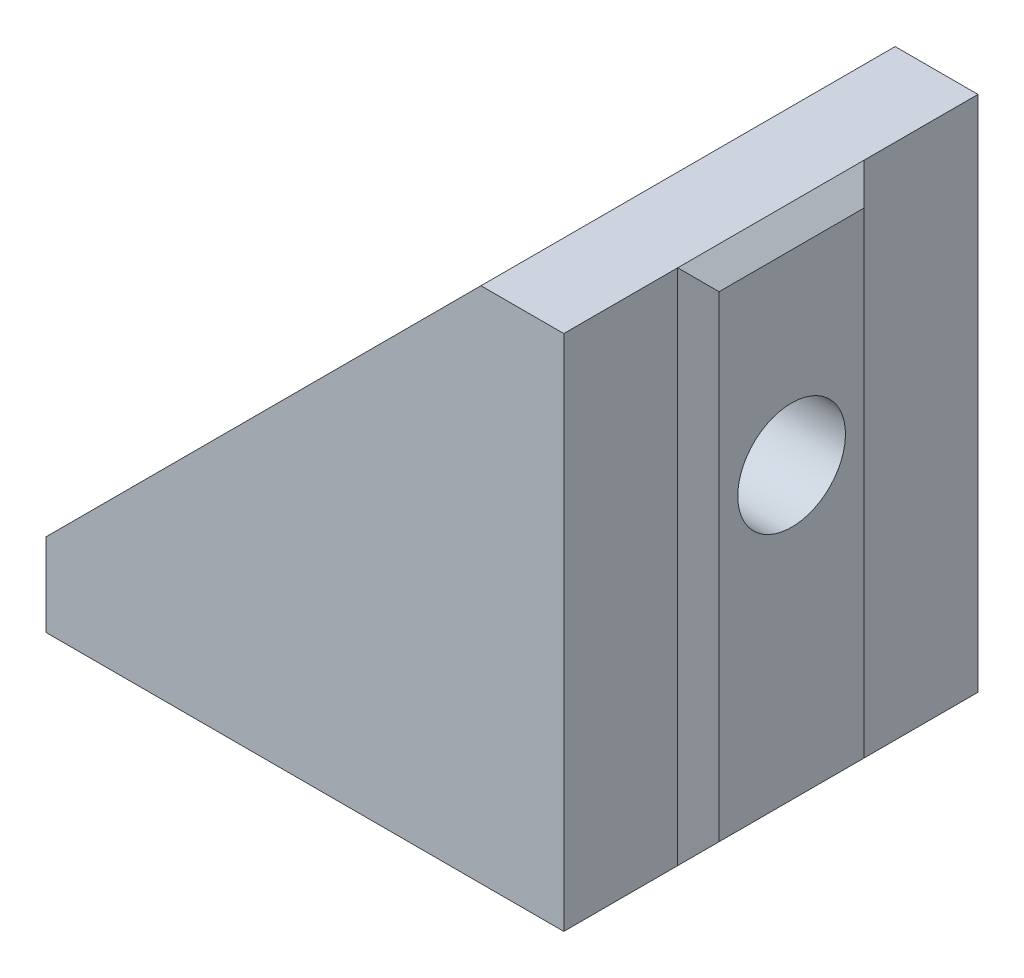
from build123d import *

# Parameters (mm, degrees)
BOSS_EXTRUDE1_DEPTH = 20
SKETCH2_W           = 9
SKETCH2_H           = 25
BOSS_EXTRUDE2_DEPTH = 1
BOSS_EXTRUDE2_TAPER = 45
SKETCH3_W           = 25
SKETCH3_H           = 9
BOSS_EXTRUDE3_DEPTH = 1
BOSS_EXTRUDE3_TAPER = 45
CUT_EXTRUDE3_DEPTH  = 3.5
SKETCH9_W           = 10
SKETCH9_H           = 8.5
CUT_EXTRUDE4_DEPTH  = 7
CHAMFER3_START      = 7.5
CHAMFER3_DEPTH      = 5
CHAMFER3_START_2    = 5
CHAMFER3_2_DEPTH    = 10
CHAMFER3_START_3    = 0.671572875
CHAMFER3_3_DEPTH    = 2.5
CUT_EXTRUDE5_REACH  = 43.857
SKETCH4_R           = 2.6
CUT_EXTRUDE6_REACH  = 43.243
SKETCH5_R           = 2.6


with BuildPart() as part:
    # Sketch1 → Boss-Extrude1 (new body)
    with BuildSketch(Plane.XY):
        Polygon((0, 0), (0, 4), (21, 25), (25, 25), (25, 0), align=None)
    extrude(amount=BOSS_EXTRUDE1_DEPTH)

    # Sketch2 → Boss-Extrude2 (add)
    with BuildSketch(Plane(origin=(25, 0, 0), x_dir=(0, 0, -1), z_dir=(1, 0, 0))):
        with Locations((-10, 12.5)):
            Rectangle(SKETCH2_W, SKETCH2_H)
    extrude(amount=BOSS_EXTRUDE2_DEPTH, taper=BOSS_EXTRUDE2_TAPER)

    # Sketch3 → Boss-Extrude3 (add)
    with BuildSketch(Plane.XZ):
        with Locations((12.5, 10)):
            Rectangle(SKETCH3_W, SKETCH3_H)
    extrude(amount=BOSS_EXTRUDE3_DEPTH, taper=BOSS_EXTRUDE3_TAPER)

    # Sketch7 → Cut-Extrude3 (cut)
    with BuildSketch(Plane(origin=(-2, 2, 0), x_dir=(0, 0, 1), z_dir=(-0.7071067811865464, 0.7071067811865487, 0))):
        with BuildLine():
            Line((7.5, 29.026911935), (12.5, 29.026911935))
            ThreePointArc((12.5, 29.026911935), (14.267766953, 28.294678888), (15, 26.526911935))
            Line((15, 26.526911935), (15, 8.826911935))
            ThreePointArc((15, 8.826911935), (14.267766953, 7.059144982), (12.5, 6.326911935))
            Line((12.5, 6.326911935), (7.5, 6.326911935))
            ThreePointArc((7.5, 6.326911935), (5.732233047, 7.059144982), (5, 8.826911935))
            Line((5, 8.826911935), (5, 26.526911935))
            ThreePointArc((5, 26.526911935), (5.732233047, 28.294678888), (7.5, 29.026911935))
        make_face()
    extrude(amount=-CUT_EXTRUDE3_DEPTH, mode=Mode.SUBTRACT)

    # Sketch9 → Cut-Extrude4 (cut)
    with BuildSketch(Plane(origin=(0.474873734, -0.474873734, 0), x_dir=(0, 0, 1), z_dir=(-0.7071067811865464, 0.7071067811865487, 0))):
        with Locations((10, 17.676911935)):
            Rectangle(SKETCH9_W, SKETCH9_H)
    extrude(amount=-CUT_EXTRUDE4_DEPTH, mode=Mode.SUBTRACT)

    # Chamfer3: read off the stored shape, not the designer's step
    # Chamfer3 outline → Chamfer3 (cut)
    with BuildSketch(Plane.XY.offset(CHAMFER3_START)):
        Polygon((15.979541854, 15.029794385), (20.929289322, 10.080046917), (21, 10.150757595), (21, 20.050252532), align=None)
        Polygon((4.948676067, 3.998928599), (14.848171004, 3.998928599), (14.918881682, 4.069639277), (9.969134213, 9.019386745), align=None)
    extrude(amount=CHAMFER3_DEPTH, mode=Mode.SUBTRACT)

    # Chamfer3 2 outline → Chamfer3 2 (cut)
    with BuildSketch(Plane.XY.offset(CHAMFER3_START_2)):
        Polygon((15.979541854, 15.029794385), (20.929289322, 10.080046917), (21, 10.150757595), (21, 20.050252532), align=None)
        Polygon((4.948676067, 3.998928599), (14.848171004, 3.998928599), (14.918881682, 4.069639277), (9.969134213, 9.019386745), align=None)
    extrude(amount=CHAMFER3_2_DEPTH, mode=Mode.SUBTRACT)

    # Chamfer3 3 outline → Chamfer3 3 (add)
    with BuildSketch(Plane(origin=(0, 0, 0), x_dir=(0.707106781186549, 0.707106781186546, 0), z_dir=(0.707106781186546, -0.707106781186549, 0)).offset(CHAMFER3_START_3)):
        with BuildLine():
            Line((6.326911935, 5.000000001), (8.826911935, 5))
            ThreePointArc((8.826911935, 5), (7.059144982, 5.732233047), (6.326911935, 7.5))
            Line((6.326911935, 7.5), (6.326911935, 5.000000001))
        make_face()
        with BuildLine():
            ThreePointArc((29.026911935, 7.5), (28.294678888, 5.732233047), (26.526911935, 5))
            Line((26.526911935, 5), (29.026911935, 5.000000001))
            Line((29.026911935, 5.000000001), (29.026911935, 7.5))
        make_face()
        with BuildLine():
            Line((6.326911935, 14.999999999), (6.326911935, 12.5))
            ThreePointArc((6.326911935, 12.5), (7.059144982, 14.267766953), (8.826911935, 15))
            Line((8.826911935, 15), (6.326911935, 14.999999999))
        make_face()
        with BuildLine():
            ThreePointArc((26.526911935, 15), (28.294678888, 14.267766953), (29.026911935, 12.5))
            Line((29.026911935, 12.5), (29.026911935, 14.999999999))
            Line((29.026911935, 14.999999999), (26.526911935, 15))
        make_face()
    extrude(amount=CHAMFER3_3_DEPTH)

    # Sketch4 → Cut-Extrude5 (cut, up to next)
    with BuildSketch(Plane.XZ.offset(1), mode=Mode.PRIVATE) as cut_extrude5_sk1:
        with Locations(Location((9, 10, 0), (0, 0, 270))):
            Circle(SKETCH4_R)
    cut_extrude5_tool1 = extrude(cut_extrude5_sk1.sketch, amount=-CUT_EXTRUDE5_REACH, mode=Mode.PRIVATE) & part.part
    add(cut_extrude5_tool1.solids().sort_by_distance((9, -1, 10))[0], mode=Mode.SUBTRACT)

    # Sketch5 → Cut-Extrude6 (cut, up to next)
    with BuildSketch(Plane(origin=(26, 0, 0), x_dir=(0, 0, -1), z_dir=(1, 0, 0)), mode=Mode.PRIVATE) as cut_extrude6_sk1:
        with Locations(Location((-10, 15, 0), (0, 0, 90))):
            Circle(SKETCH5_R)
    cut_extrude6_tool1 = extrude(cut_extrude6_sk1.sketch, amount=-CUT_EXTRUDE6_REACH, mode=Mode.PRIVATE) & part.part
    add(cut_extrude6_tool1.solids().sort_by_distance((26, 15, 10))[0], mode=Mode.SUBTRACT)


solid = part.part
